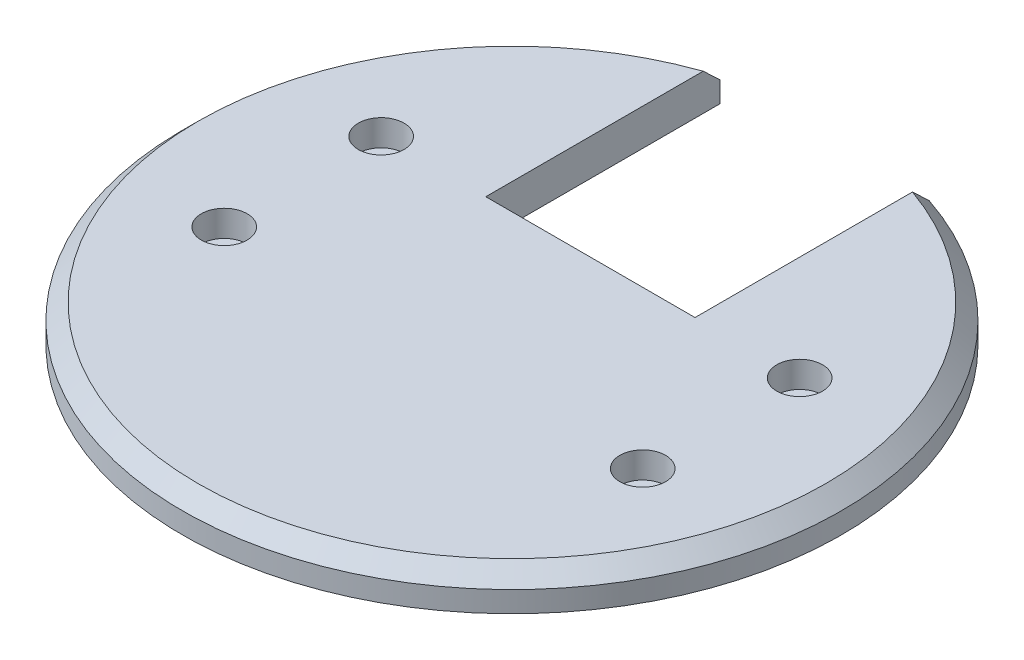
from build123d import *

# Parameters (mm, degrees)
SKETCH1_R           = 63
SKETCH1_R_2         = 2.625
BOSS_EXTRUDE1_DEPTH = 7
SKETCH2_R           = 4.375
CUT_EXTRUDE1_DEPTH  = 5
CUT_EXTRUDE2_REACH  = 91.37
SKETCH3_W           = 40
SKETCH3_H           = 50


with BuildPart() as part:
    # Sketch1 → Boss-Extrude1 (new body)
    with BuildSketch(Plane(origin=(0, 0, 0), x_dir=(1, 0, 0), z_dir=(0, 1, 0))):
        with Locations(Location((0, 0, 0), (0, 0, 270))):
            Circle(SKETCH1_R)
        with Locations(Location((-40, 15, 0), (0, 0, 270))):
            Circle(SKETCH1_R_2, mode=Mode.SUBTRACT)
        with Locations(Location((-40, -15, 0), (0, 0, 270))):
            Circle(SKETCH1_R_2, mode=Mode.SUBTRACT)
        with Locations(Location((40, 15, 0), (0, 0, 270))):
            Circle(SKETCH1_R_2, mode=Mode.SUBTRACT)
        with Locations(Location((40, -15, 0), (0, 0, 270))):
            Circle(SKETCH1_R_2, mode=Mode.SUBTRACT)
    extrude(amount=BOSS_EXTRUDE1_DEPTH)

    # Sketch2 → Cut-Extrude1 (cut)
    with BuildSketch(Plane(origin=(0, 7, 0), x_dir=(1, 0, 0), z_dir=(0, 1, 0))):
        with Locations(Location((-40, 15, 0), (0, 0, 270))):
            Circle(SKETCH2_R)
        with Locations(Location((-40, -15, 0), (0, 0, 270))):
            Circle(SKETCH2_R)
        with Locations(Location((40, 15, 0), (0, 0, 270))):
            Circle(SKETCH2_R)
        with Locations(Location((40, -15, 0), (0, 0, 270))):
            Circle(SKETCH2_R)
    extrude(amount=-CUT_EXTRUDE1_DEPTH, mode=Mode.SUBTRACT)

    # Chamfer1: read off the stored shape, not the designer's step
    # Chamfer1 outline → Chamfer1 (revolve, cut)
    with BuildSketch(Plane.XY):
        Polygon((63, 7), (60, 7), (63, 4), align=None)
    revolve(axis=Axis((0, 0, 0), (0, 1, 0)), mode=Mode.SUBTRACT)

    # Cut-Extrude2: up to this face of the body (flat: up to its plane)
    cut_extrude2_end = Plane(part.part.faces().sort_by_distance((0, 0, 0))[0])
    # Sketch3 → Cut-Extrude2 (cut, up to the picked face)
    with BuildSketch(Plane(origin=(0, 7, 0), x_dir=(1, 0, 0), z_dir=(0, 1, 0)), mode=Mode.PRIVATE) as cut_extrude2_sk1:
        with Locations((0, 40)):
            Rectangle(SKETCH3_W, SKETCH3_H)
    cut_extrude2_tool1 = split(extrude(cut_extrude2_sk1.sketch, amount=-CUT_EXTRUDE2_REACH, mode=Mode.PRIVATE), bisect_by=cut_extrude2_end, keep=Keep.BOTH, mode=Mode.PRIVATE)
    add(cut_extrude2_tool1.solids().sort_by(Axis((0, 7, -40), (0, -1, 0)))[0], mode=Mode.SUBTRACT)


solid = part.part
